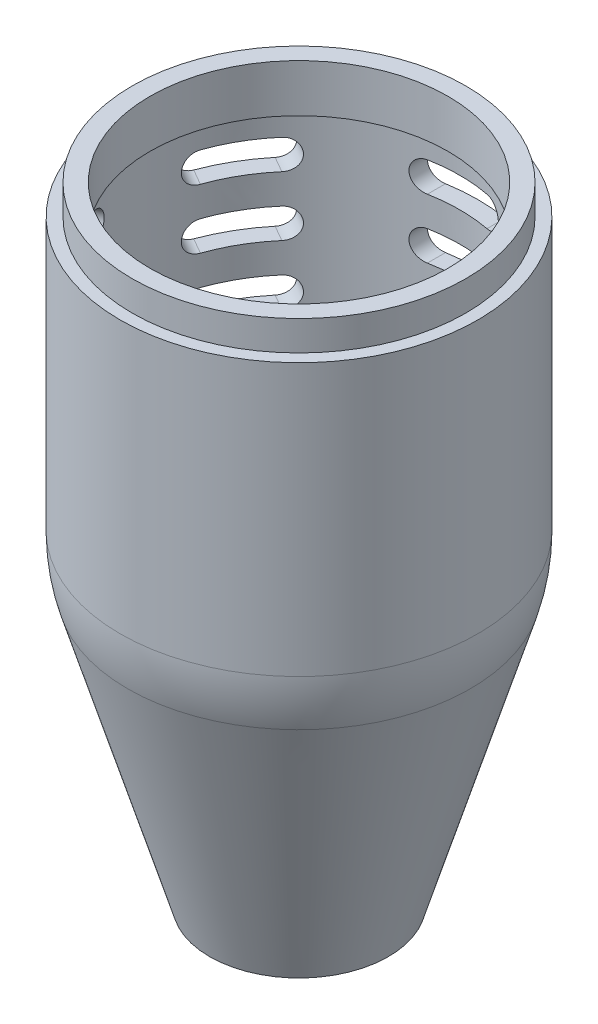
from build123d import *
from build123d.topology import SkipClean

# Parameters (mm, degrees)
SKETCH2_R                = 28
SKETCH2_R_2              = 25
EXTRUDE_THIN1_DEPTH      = 5
CUT_EXTRUDE1_DEPTH       = 114.247516529
LPATTERN6_COUNT          = 4
LPATTERN6_PITCH          = 10
CIRPATTERN1_COUNT        = 3
CIRPATTERN1_ANGLE        = 120
CIRPATTERN1_COPY_1_DEPTH = 114.247516529
CIRPATTERN1_COPY_2_DEPTH = 114.247516529
CIRPATTERN1_COPY_3_DEPTH = 114.247516529
CIRPATTERN1_COPY_4_DEPTH = 114.247516529
CIRPATTERN1_COPY_5_DEPTH = 114.247516529
CIRPATTERN1_COPY_6_DEPTH = 114.247516529


# Read off the part's stored shape, not the designer's step: Shell2
with BuildPart() as part:
    # Sketch1 → Revolve1 (revolve)
    with BuildSketch(Plane.XY, mode=Mode.PRIVATE) as revolve1_sk:
        with BuildLine():
            Line((0, 0), (0, 100))
            Line((0, 100), (30, 100))
            Line((30, 100), (30, 54.403065089))
            ThreePointArc((30, 54.403065089), (29.682011865, 50.046670749), (28.734788557, 45.782628522))
            Line((28.734788557, 45.782628522), (15, 0))
            Line((15, 0), (0, 0))
        make_face()
    revolve(revolve1_sk.sketch.rotate(Axis((0, 126.662122273, 0), (0, -1, 0)), 90), axis=Axis((0, 126.662122273, 0), (0, -1, 0)))

    # Sketch2 → Extrude-Thin1 (add)
    with BuildSketch(Plane(origin=(0, 100, 0), x_dir=(-1, 0, 0), z_dir=(0, 1, 0))):
        Circle(SKETCH2_R)
        Circle(SKETCH2_R_2, mode=Mode.SUBTRACT)
    extrude(amount=EXTRUDE_THIN1_DEPTH)

    # Shell2 outline → Shell2 (revolve, cut)
    with SkipClean():  # the faces are left unmerged after this step: merging them gives an invalid solid
        with BuildSketch(Plane.XY):
            with BuildLine():
                Line((25, 97), (25, 100))
                Line((25, 100), (0, 100))
                Line((0, 100), (0, 0))
                Line((0, 0), (11.867908047, 0))
                Line((11.867908047, 0), (25.861309693, 46.644672153))
                ThreePointArc((25.861309693, 46.644672153), (26.713810678, 50.482310183), (27, 54.403065116))
                Line((27, 54.403065116), (27, 97))
                Line((27, 97), (25, 97))
            make_face()
        revolve(axis=Axis((0, 0, 0), (0, 1, 0)), mode=Mode.SUBTRACT)

    # Sketch3 → Cut-Extrude1 (cut, through all)
    with SkipClean():  # the faces are left unmerged after this step: merging them gives an invalid solid
        with BuildSketch(Plane.XY):
            with BuildLine():
                Line((-5, 62.5), (5, 62.5))
                ThreePointArc((5, 62.5), (7.5, 60), (5, 57.5))
                Line((5, 57.5), (-5, 57.5))
                ThreePointArc((-5, 57.5), (-7.5, 60), (-5, 62.5))
            make_face()
        cut_extrude1 = extrude(amount=-CUT_EXTRUDE1_DEPTH, mode=Mode.SUBTRACT)

    # LPattern6: Cut-Extrude1 ×4
    with SkipClean():  # the faces are left unmerged after this step: merging them gives an invalid solid
        with Locations(*[(0, i * LPATTERN6_PITCH, 0) for i in range(1, LPATTERN6_COUNT)]):
            add(cut_extrude1, mode=Mode.SUBTRACT)

    # CirPattern1: Cut-Extrude1 ×3 about axis
    with SkipClean():  # the faces are left unmerged after this step: merging them gives an invalid solid
        cirpattern1_axis = Axis((0, 126.662122273, 0), (0, 1, 0))
        for i in range(1, CIRPATTERN1_COUNT):
            add(cut_extrude1.rotate(cirpattern1_axis, i * CIRPATTERN1_ANGLE / (CIRPATTERN1_COUNT - 1)), mode=Mode.SUBTRACT)

    # CirPattern1 copy 1 sketch → CirPattern1 copy 1 (cut, through all)
    with SkipClean():  # the faces are left unmerged after this step: merging them gives an invalid solid
        with BuildSketch(Plane(origin=(0, 10, 0), x_dir=(0.499999999999998, 0, -0.8660254037844398), z_dir=(0.8660254037844398, 0, 0.499999999999998))):
            with BuildLine():
                Line((-5, 62.5), (5, 62.5))
                ThreePointArc((5, 62.5), (7.5, 60), (5, 57.5))
                Line((5, 57.5), (-5, 57.5))
                ThreePointArc((-5, 57.5), (-7.5, 60), (-5, 62.5))
            make_face()
        extrude(amount=-CIRPATTERN1_COPY_1_DEPTH, mode=Mode.SUBTRACT)

    # CirPattern1 copy 2 sketch → CirPattern1 copy 2 (cut, through all)
    with SkipClean():  # the faces are left unmerged after this step: merging them gives an invalid solid
        with BuildSketch(Plane(origin=(0, 10, 0), x_dir=(-0.500000000000004, 0, -0.8660254037844363), z_dir=(0.8660254037844363, 0, -0.500000000000004))):
            with BuildLine():
                Line((-5, 62.5), (5, 62.5))
                ThreePointArc((5, 62.5), (7.5, 60), (5, 57.5))
                Line((5, 57.5), (-5, 57.5))
                ThreePointArc((-5, 57.5), (-7.5, 60), (-5, 62.5))
            make_face()
        extrude(amount=-CIRPATTERN1_COPY_2_DEPTH, mode=Mode.SUBTRACT)

    # CirPattern1 copy 3 sketch → CirPattern1 copy 3 (cut, through all)
    with SkipClean():  # the faces are left unmerged after this step: merging them gives an invalid solid
        with BuildSketch(Plane(origin=(0, 20, 0), x_dir=(0.499999999999998, 0, -0.8660254037844398), z_dir=(0.8660254037844398, 0, 0.499999999999998))):
            with BuildLine():
                Line((-5, 62.5), (5, 62.5))
                ThreePointArc((5, 62.5), (7.5, 60), (5, 57.5))
                Line((5, 57.5), (-5, 57.5))
                ThreePointArc((-5, 57.5), (-7.5, 60), (-5, 62.5))
            make_face()
        extrude(amount=-CIRPATTERN1_COPY_3_DEPTH, mode=Mode.SUBTRACT)

    # CirPattern1 copy 4 sketch → CirPattern1 copy 4 (cut, through all)
    with SkipClean():  # the faces are left unmerged after this step: merging them gives an invalid solid
        with BuildSketch(Plane(origin=(0, 20, 0), x_dir=(-0.500000000000004, 0, -0.8660254037844363), z_dir=(0.8660254037844363, 0, -0.500000000000004))):
            with BuildLine():
                Line((-5, 62.5), (5, 62.5))
                ThreePointArc((5, 62.5), (7.5, 60), (5, 57.5))
                Line((5, 57.5), (-5, 57.5))
                ThreePointArc((-5, 57.5), (-7.5, 60), (-5, 62.5))
            make_face()
        extrude(amount=-CIRPATTERN1_COPY_4_DEPTH, mode=Mode.SUBTRACT)

    # CirPattern1 copy 5 sketch → CirPattern1 copy 5 (cut, through all)
    with SkipClean():  # the faces are left unmerged after this step: merging them gives an invalid solid
        with BuildSketch(Plane(origin=(0, 30, 0), x_dir=(0.499999999999998, 0, -0.8660254037844398), z_dir=(0.8660254037844398, 0, 0.499999999999998))):
            with BuildLine():
                Line((-5, 62.5), (5, 62.5))
                ThreePointArc((5, 62.5), (7.5, 60), (5, 57.5))
                Line((5, 57.5), (-5, 57.5))
                ThreePointArc((-5, 57.5), (-7.5, 60), (-5, 62.5))
            make_face()
        extrude(amount=-CIRPATTERN1_COPY_5_DEPTH, mode=Mode.SUBTRACT)

    # CirPattern1 copy 6 sketch → CirPattern1 copy 6 (cut, through all)
    with SkipClean():  # the faces are left unmerged after this step: merging them gives an invalid solid
        with BuildSketch(Plane(origin=(0, 30, 0), x_dir=(-0.500000000000004, 0, -0.8660254037844363), z_dir=(0.8660254037844363, 0, -0.500000000000004))):
            with BuildLine():
                Line((-5, 62.5), (5, 62.5))
                ThreePointArc((5, 62.5), (7.5, 60), (5, 57.5))
                Line((5, 57.5), (-5, 57.5))
                ThreePointArc((-5, 57.5), (-7.5, 60), (-5, 62.5))
            make_face()
        extrude(amount=-CIRPATTERN1_COPY_6_DEPTH, mode=Mode.SUBTRACT)


solid = part.part
